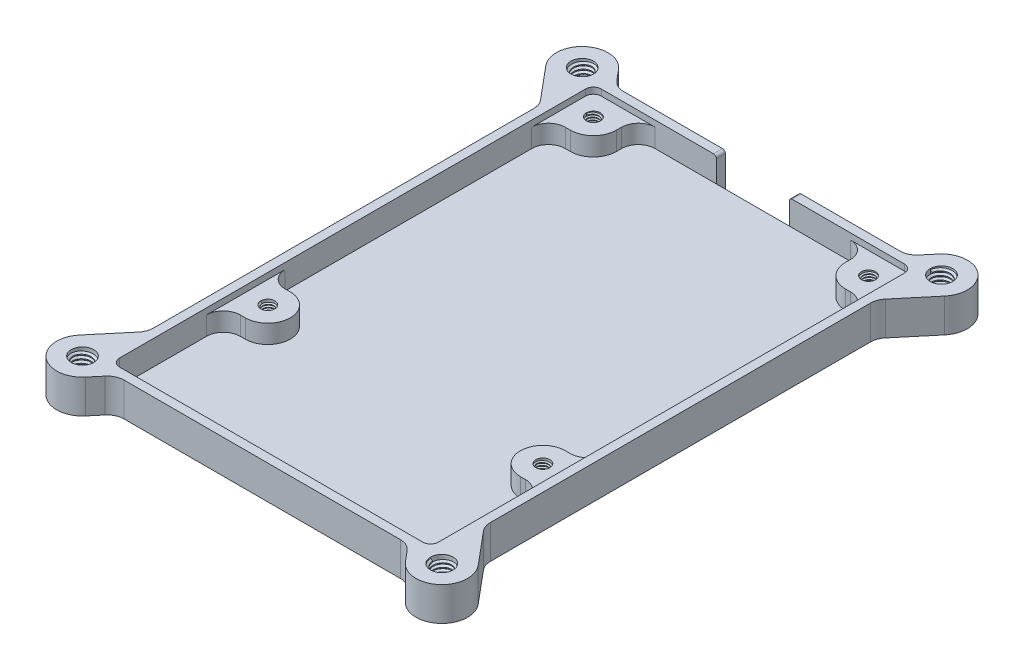
from build123d import *

# Parameters (mm, degrees)
SKETCH1_W                                 = 60
SKETCH1_H                                 = 89
BASE_DEPTH                                = 6
OUTSIDE_OF_BASE_R                         = 3
SHELL_T                                   = -1.6
SKETCH11_W                                = 13
SKETCH11_H                                = 6
SD_CARD_ACCESS_DEPTH                      = 1.6
TOP_START                                 = 6
TOP_COVER_FASTENING_BODY_DEPTH            = 6
M4X0_7_TAPPED_HOLE1_D                     = 4
THREAD1_PITCH                             = 0.7
TCFB_START                                = 6
TCFB_VM_COPY_1_DEPTH                      = 6
TCFB_VM_COPY_2_D                          = 4
TCFB_VM_COPY_3_PITCH                      = 0.7
FASTENER_START                            = 3.3
FASTENER_BOSSED_MOUNT_DEPTH               = 3.3
TAPPED_HOLE_D                             = 2.5
SKETCH_PATTERN_START                      = -1
SKETCH_PATTERN_M2_5_TAPPED_HOLE_OUTLINE_R = 1.25
SKETCH_PATTERN_M2_5_TAPPED_HOLE_DEPTH     = 5.9
M2_5_3D_PRINTED_THREAD_PITCH              = 0.45
TM_V_COPY_1_PITCH                         = 0.45
SDCA_F_R                                  = 0.5
FBM_F_R                                   = 3
TCFB_INNER_FILLET_R                       = 3
TCFB_OUTER_FILLET_R                       = 3


with BuildPart() as part:
    # Sketch1 → BASE (new body)
    with BuildSketch(Plane(origin=(0, 0, 0), x_dir=(1, 0, 0), z_dir=(0, 1, 0))):
        Rectangle(SKETCH1_W, SKETCH1_H)
    extrude(amount=BASE_DEPTH)

    # OUTSIDE OF BASE
    outside_of_base_edges = [part.edges().sort_by_distance(p)[0] for p in [
        (30, 3, 44.5),
        (-30, 3, 44.5),
        (-30, 3, -44.5),
        (30, 3, -44.5),
    ]]
    fillet(outside_of_base_edges, radius=OUTSIDE_OF_BASE_R)

    # SHELL
    shell_openings = [part.faces().sort_by_distance(p)[0] for p in [
        (0, 6, 0),
    ]]
    offset(amount=SHELL_T, openings=shell_openings, kind=Kind.INTERSECTION)

    # Sketch11 → SD CARD ACCESS (cut)
    with BuildSketch(Plane(origin=(0, 0, -44.5), x_dir=(-1, 0, 0), z_dir=(0, 0, -1))):
        with Locations((0, 3)):
            Rectangle(SKETCH11_W, SKETCH11_H)
    extrude(amount=-SD_CARD_ACCESS_DEPTH, mode=Mode.SUBTRACT)

    # Sketch21 → TOP COVER FASTENING BODY (add)
    with BuildSketch(Plane(origin=(0, 0, 0), x_dir=(1, 0, 0), z_dir=(0, 1, 0)).offset(TOP_START)):
        with BuildLine():
            Line((30, 41.5), (30, 34.947195978))
            Line((30, 34.947195978), (35.526666667, 41.546591423))
            ThreePointArc((35.526666667, 41.546591423), (34.953408577, 48.026666667), (28.473333333, 47.453408577))
            Line((28.473333333, 47.453408577), (26, 44.5))
            Line((26, 44.5), (27, 44.5))
            ThreePointArc((27, 44.5), (29.121320344, 43.621320344), (30, 41.5))
        make_face()
    top_cover_fastening_body = extrude(amount=-TOP_COVER_FASTENING_BODY_DEPTH)

    # M4x0.7 Tapped Hole1 (through all)
    with Locations(Plane(origin=(0, 6, 0), x_dir=(1, 0, 0), z_dir=(0, 1, 0))):
        with Locations((32, 44.5)):
            m4x0_7_tapped_hole1 = Hole(M4X0_7_TAPPED_HOLE1_D / 2)

    # Thread1: arcs per turn and ends read off the stored shape
    # Thread1: the profile of Thread Profile2 profile screwed along a right-hand helix through 7.428569 turns, 6 arcs to a turn; built about Z, then put on its axis
    thread1_z = Axis((0, 0, 0), (0, 0, 1))
    thread1_corners = [(2.0003, 0, -0.000173205), (2.0003, 0, 0.612673203), (1.621113888, 0, 0.393749999), (1.621113888, 0, 0.218749999)]
    with BuildLine(mode=Mode.PRIVATE) as thread1_profile:
        Line(thread1_corners[0], thread1_corners[1])
        Line(thread1_corners[1], thread1_corners[2])
        Line(thread1_corners[2], thread1_corners[3])
        Line(thread1_corners[3], thread1_corners[0])
    thread1_cap = Face(thread1_profile.wire())
    thread1_turn_angles = [0, 30, 60, 90, 120, 150, 180, 210, 240, 270, 300, 330, 360]
    thread1_turn_weights = [1, 0.8660254037844387, 1, 0.8660254037844387, 1, 0.8660254037844387, 1, 0.8660254037844387, 1, 0.8660254037844387, 1, 0.8660254037844387, 1]
    thread1_turn_rails = [Edge.make_bspline([Vector(p[0], p[1], 0).rotate(thread1_z, thread1_turn_angles[k]) / thread1_turn_weights[k] + Vector(0, 0, p[2] + THREAD1_PITCH * thread1_turn_angles[k] / 360) for k in range(13)], [0, 0, 0, 1, 1, 2, 2, 3, 3, 4, 4, 5, 5, 6, 6, 6], 2, thread1_turn_weights) for p in thread1_corners]
    thread1_turn_sides = [Face.make_surface_from_curves(thread1_turn_rails[p[0]], thread1_turn_rails[p[1]]) for p in [(0, 1), (1, 2), (2, 3), (3, 0)]]
    thread1_last_angles = [2520, 2550, 2580, 2610, 2640, 2657.1425, 2674.285]
    thread1_last_weights = [1, 0.8660254037844387, 1, 0.8660254037844387, 1, 0.9555746430705345, 1]
    thread1_last_rails = [Edge.make_bspline([Vector(p[0], p[1], 0).rotate(thread1_z, thread1_last_angles[k]) / thread1_last_weights[k] + Vector(0, 0, p[2] + THREAD1_PITCH * thread1_last_angles[k] / 360) for k in range(7)], [0, 0, 0, 1, 1, 2, 2, 3, 3, 3], 2, thread1_last_weights) for p in thread1_corners]
    thread1_last_sides = [Face.make_surface_from_curves(thread1_last_rails[p[0]], thread1_last_rails[p[1]]) for p in [(0, 1), (1, 2), (2, 3), (3, 0)]]
    thread1 = Plane(origin=(32, 5.8, -44.5), x_dir=(-1, 0, 0), z_dir=(0, -1, 0)) * Solid(Shell([*[p.moved(Location((0, 0, THREAD1_PITCH * i))) for i in range(7) for p in thread1_turn_sides], *thread1_last_sides, thread1_cap, thread1_cap.rotate(thread1_z, 2674.285).moved(Location((0, 0, THREAD1_PITCH * 2674.285 / 360)))]))
    add(thread1)

    # TCFB HM: TOP COVER FASTENING BODY, M4x0.7 Tapped Hole1, Thread1 across plane
    add(top_cover_fastening_body.mirror(Plane(origin=(0, 0, 0), x_dir=(0, 0, 1), z_dir=(1, 0, 0))))
    add(m4x0_7_tapped_hole1.mirror(Plane(origin=(0, 0, 0), x_dir=(0, 0, 1), z_dir=(1, 0, 0))), mode=Mode.SUBTRACT)
    add(thread1.mirror(Plane(origin=(0, 0, 0), x_dir=(0, 0, 1), z_dir=(1, 0, 0))))

    # TCFB VM: TOP COVER FASTENING BODY, M4x0.7 Tapped Hole1, Thread1 across plane
    add(top_cover_fastening_body.mirror(Plane.XY))
    add(m4x0_7_tapped_hole1.mirror(Plane.XY), mode=Mode.SUBTRACT)
    add(thread1.mirror(Plane.XY))

    # TCFB VM copy 1 sketch → TCFB VM copy 1 (add)
    with BuildSketch(Plane(origin=(0, 0, 0), x_dir=(-1, 0, 0), z_dir=(0, 1, 0)).offset(TCFB_START)):
        with BuildLine():
            Line((30, 41.5), (30, 34.947195978))
            Line((30, 34.947195978), (35.526666667, 41.546591423))
            ThreePointArc((35.526666667, 41.546591423), (34.953408577, 48.026666667), (28.473333333, 47.453408577))
            Line((28.473333333, 47.453408577), (26, 44.5))
            Line((26, 44.5), (27, 44.5))
            ThreePointArc((27, 44.5), (29.121320344, 43.621320344), (30, 41.5))
        make_face()
    extrude(amount=-TCFB_VM_COPY_1_DEPTH)

    # TCFB VM copy 2 (through all)
    with Locations(Plane(origin=(0, 6, 0), x_dir=(-1, 0, 0), z_dir=(0, 1, 0))):
        with Locations((32, 44.5)):
            Hole(TCFB_VM_COPY_2_D / 2)

    # TCFB VM copy 3: the profile of TCFB VM copy 3 sketch screwed along a right-hand helix through 7.428569 turns, 6 arcs to a turn; built about Z, then put on its axis
    tcfb_vm_copy_3_z = Axis((0, 0, 0), (0, 0, 1))
    tcfb_vm_copy_3_corners = [(2.0003, 0, -0.000173205), (2.0003, 0, 0.612673203), (1.621113888, 0, 0.393749999), (1.621113888, 0, 0.218749999)]
    with BuildLine(mode=Mode.PRIVATE) as tcfb_vm_copy_3_profile:
        Line(tcfb_vm_copy_3_corners[0], tcfb_vm_copy_3_corners[1])
        Line(tcfb_vm_copy_3_corners[1], tcfb_vm_copy_3_corners[2])
        Line(tcfb_vm_copy_3_corners[2], tcfb_vm_copy_3_corners[3])
        Line(tcfb_vm_copy_3_corners[3], tcfb_vm_copy_3_corners[0])
    tcfb_vm_copy_3_cap = Face(tcfb_vm_copy_3_profile.wire())
    tcfb_vm_copy_3_turn_angles = [0, 30, 60, 90, 120, 150, 180, 210, 240, 270, 300, 330, 360]
    tcfb_vm_copy_3_turn_weights = [1, 0.8660254037844387, 1, 0.8660254037844387, 1, 0.8660254037844387, 1, 0.8660254037844387, 1, 0.8660254037844387, 1, 0.8660254037844387, 1]
    tcfb_vm_copy_3_turn_rails = [Edge.make_bspline([Vector(p[0], p[1], 0).rotate(tcfb_vm_copy_3_z, tcfb_vm_copy_3_turn_angles[k]) / tcfb_vm_copy_3_turn_weights[k] + Vector(0, 0, p[2] + TCFB_VM_COPY_3_PITCH * tcfb_vm_copy_3_turn_angles[k] / 360) for k in range(13)], [0, 0, 0, 1, 1, 2, 2, 3, 3, 4, 4, 5, 5, 6, 6, 6], 2, tcfb_vm_copy_3_turn_weights) for p in tcfb_vm_copy_3_corners]
    tcfb_vm_copy_3_turn_sides = [Face.make_surface_from_curves(tcfb_vm_copy_3_turn_rails[p[0]], tcfb_vm_copy_3_turn_rails[p[1]]) for p in [(0, 1), (1, 2), (2, 3), (3, 0)]]
    tcfb_vm_copy_3_last_angles = [2520, 2550, 2580, 2610, 2640, 2657.1425, 2674.285]
    tcfb_vm_copy_3_last_weights = [1, 0.8660254037844387, 1, 0.8660254037844387, 1, 0.9555746430705345, 1]
    tcfb_vm_copy_3_last_rails = [Edge.make_bspline([Vector(p[0], p[1], 0).rotate(tcfb_vm_copy_3_z, tcfb_vm_copy_3_last_angles[k]) / tcfb_vm_copy_3_last_weights[k] + Vector(0, 0, p[2] + TCFB_VM_COPY_3_PITCH * tcfb_vm_copy_3_last_angles[k] / 360) for k in range(7)], [0, 0, 0, 1, 1, 2, 2, 3, 3, 3], 2, tcfb_vm_copy_3_last_weights) for p in tcfb_vm_copy_3_corners]
    tcfb_vm_copy_3_last_sides = [Face.make_surface_from_curves(tcfb_vm_copy_3_last_rails[p[0]], tcfb_vm_copy_3_last_rails[p[1]]) for p in [(0, 1), (1, 2), (2, 3), (3, 0)]]
    tcfb_vm_copy_3 = Plane(origin=(-32, 5.8, 44.5), x_dir=(1, 0, 0), z_dir=(0, -1, 0)) * Solid(Shell([*[p.moved(Location((0, 0, TCFB_VM_COPY_3_PITCH * i))) for i in range(7) for p in tcfb_vm_copy_3_turn_sides], *tcfb_vm_copy_3_last_sides, tcfb_vm_copy_3_cap, tcfb_vm_copy_3_cap.rotate(tcfb_vm_copy_3_z, 2674.285).moved(Location((0, 0, TCFB_VM_COPY_3_PITCH * 2674.285 / 360)))]))
    add(tcfb_vm_copy_3)

    # Sketch3 → FASTENER BOSSED MOUNT (add)
    with BuildSketch(Plane(origin=(0, 1.6, 0), x_dir=(1, 0, 0), z_dir=(0, 1, 0)).offset(FASTENER_START)):
        with BuildLine():
            Line((-28.4, 41.5), (-28.4, 34.9))
            Line((-28.4, 34.9), (-24.5, 34.9))
            ThreePointArc((-24.5, 34.9), (-21.600862197, 36.100862197), (-20.4, 39))
            Line((-20.4, 39), (-20.4, 42.9))
            Line((-20.4, 42.9), (-27, 42.9))
            ThreePointArc((-27, 42.9), (-27.989949494, 42.489949494), (-28.4, 41.5))
        make_face()
        with BuildLine():
            Line((-28.4, -23), (-24.5, -23))
            ThreePointArc((-24.5, -23), (-20.5, -19), (-24.5, -15))
            Line((-24.5, -15), (-28.4, -15))
            Line((-28.4, -15), (-28.4, -23))
        make_face()
    fastener_bossed_mount = extrude(amount=-FASTENER_BOSSED_MOUNT_DEPTH)

    # FBM M: FASTENER BOSSED MOUNT across plane
    add(fastener_bossed_mount.mirror(Plane(origin=(0, 0, 0), x_dir=(0, 0, 1), z_dir=(1, 0, 0))))

    # Tapped Hole (through all)
    with Locations(Plane(origin=(0, 4.9, 0), x_dir=(1, 0, 0), z_dir=(0, 1, 0))):
        with Locations((-24.5, 39)):
            Hole(TAPPED_HOLE_D / 2)

    # Sketch-Pattern M2.5 TAPPED HOLE: read off the stored shape, not the designer's step
    # Sketch-Pattern M2.5 TAPPED HOLE outline → Sketch-Pattern M2.5 TAPPED HOLE (cut)
    with BuildSketch(Plane(origin=(0, 0, 0), x_dir=(1, 0, 0), z_dir=(0, 1, 0)).offset(SKETCH_PATTERN_START)):
        with Locations((-24.5, -19)):
            Circle(SKETCH_PATTERN_M2_5_TAPPED_HOLE_OUTLINE_R)
        with Locations((24.5, -19)):
            Circle(SKETCH_PATTERN_M2_5_TAPPED_HOLE_OUTLINE_R)
        with Locations((24.5, 39)):
            Circle(SKETCH_PATTERN_M2_5_TAPPED_HOLE_OUTLINE_R)
    extrude(amount=SKETCH_PATTERN_M2_5_TAPPED_HOLE_DEPTH, mode=Mode.SUBTRACT)

    # M2.5 3D PRINTED THREAD: arcs per turn and ends read off the stored shape
    # M2.5 3D PRINTED THREAD: the profile of Thread Profile1 profile screwed along a right-hand helix through 9.333333 turns, 6 arcs to a turn; built about Z, then put on its axis
    m2_5_3d_printed_thread_z = Axis((0, 0, 0), (0, 0, 1))
    m2_5_3d_printed_thread_corners = [(1.2503, 0, -0.000173205), (1.2503, 0, 0.393923204), (1.006430356, 0, 0.253124999), (1.006430356, 0, 0.140624999)]
    with BuildLine(mode=Mode.PRIVATE) as m2_5_3d_printed_thread_profile:
        Line(m2_5_3d_printed_thread_corners[0], m2_5_3d_printed_thread_corners[1])
        Line(m2_5_3d_printed_thread_corners[1], m2_5_3d_printed_thread_corners[2])
        Line(m2_5_3d_printed_thread_corners[2], m2_5_3d_printed_thread_corners[3])
        Line(m2_5_3d_printed_thread_corners[3], m2_5_3d_printed_thread_corners[0])
    m2_5_3d_printed_thread_cap = Face(m2_5_3d_printed_thread_profile.wire())
    m2_5_3d_printed_thread_turn_angles = [0, 30, 60, 90, 120, 150, 180, 210, 240, 270, 300, 330, 360]
    m2_5_3d_printed_thread_turn_weights = [1, 0.8660254037844387, 1, 0.8660254037844387, 1, 0.8660254037844387, 1, 0.8660254037844387, 1, 0.8660254037844387, 1, 0.8660254037844387, 1]
    m2_5_3d_printed_thread_turn_rails = [Edge.make_bspline([Vector(p[0], p[1], 0).rotate(m2_5_3d_printed_thread_z, m2_5_3d_printed_thread_turn_angles[k]) / m2_5_3d_printed_thread_turn_weights[k] + Vector(0, 0, p[2] + M2_5_3D_PRINTED_THREAD_PITCH * m2_5_3d_printed_thread_turn_angles[k] / 360) for k in range(13)], [0, 0, 0, 1, 1, 2, 2, 3, 3, 4, 4, 5, 5, 6, 6, 6], 2, m2_5_3d_printed_thread_turn_weights) for p in m2_5_3d_printed_thread_corners]
    m2_5_3d_printed_thread_turn_sides = [Face.make_surface_from_curves(m2_5_3d_printed_thread_turn_rails[p[0]], m2_5_3d_printed_thread_turn_rails[p[1]]) for p in [(0, 1), (1, 2), (2, 3), (3, 0)]]
    m2_5_3d_printed_thread_last_angles = [3240, 3270, 3300, 3330, 3360]
    m2_5_3d_printed_thread_last_weights = [1, 0.8660254037844387, 1, 0.8660254037844387, 1]
    m2_5_3d_printed_thread_last_rails = [Edge.make_bspline([Vector(p[0], p[1], 0).rotate(m2_5_3d_printed_thread_z, m2_5_3d_printed_thread_last_angles[k]) / m2_5_3d_printed_thread_last_weights[k] + Vector(0, 0, p[2] + M2_5_3D_PRINTED_THREAD_PITCH * m2_5_3d_printed_thread_last_angles[k] / 360) for k in range(5)], [0, 0, 0, 1, 1, 2, 2, 2], 2, m2_5_3d_printed_thread_last_weights) for p in m2_5_3d_printed_thread_corners]
    m2_5_3d_printed_thread_last_sides = [Face.make_surface_from_curves(m2_5_3d_printed_thread_last_rails[p[0]], m2_5_3d_printed_thread_last_rails[p[1]]) for p in [(0, 1), (1, 2), (2, 3), (3, 0)]]
    m2_5_3d_printed_thread = Plane(origin=(-24.5, 4.8, -39), x_dir=(-1, 0, 0), z_dir=(0, -1, 0)) * Solid(Shell([*[p.moved(Location((0, 0, M2_5_3D_PRINTED_THREAD_PITCH * i))) for i in range(9) for p in m2_5_3d_printed_thread_turn_sides], *m2_5_3d_printed_thread_last_sides, m2_5_3d_printed_thread_cap, m2_5_3d_printed_thread_cap.rotate(m2_5_3d_printed_thread_z, 3360).moved(Location((0, 0, M2_5_3D_PRINTED_THREAD_PITCH * 3360 / 360)))]))
    add(m2_5_3d_printed_thread)

    # TM H: M2.5 3D PRINTED THREAD across plane
    add(m2_5_3d_printed_thread.mirror(Plane(origin=(0, 0, 0), x_dir=(0, 0, 1), z_dir=(1, 0, 0))))

    # TM V: M2.5 3D PRINTED THREAD across plane
    add(m2_5_3d_printed_thread.mirror(Plane.XY.offset(-10)))

    # TM V copy 1: the profile of TM V copy 1 sketch screwed along a right-hand helix through 9.333333 turns, 6 arcs to a turn; built about Z, then put on its axis
    tm_v_copy_1_z = Axis((0, 0, 0), (0, 0, 1))
    tm_v_copy_1_corners = [(1.2503, 0, -0.000173205), (1.2503, 0, 0.393923204), (1.006430356, 0, 0.253124999), (1.006430356, 0, 0.140624999)]
    with BuildLine(mode=Mode.PRIVATE) as tm_v_copy_1_profile:
        Line(tm_v_copy_1_corners[0], tm_v_copy_1_corners[1])
        Line(tm_v_copy_1_corners[1], tm_v_copy_1_corners[2])
        Line(tm_v_copy_1_corners[2], tm_v_copy_1_corners[3])
        Line(tm_v_copy_1_corners[3], tm_v_copy_1_corners[0])
    tm_v_copy_1_cap = Face(tm_v_copy_1_profile.wire())
    tm_v_copy_1_turn_angles = [0, 30, 60, 90, 120, 150, 180, 210, 240, 270, 300, 330, 360]
    tm_v_copy_1_turn_weights = [1, 0.8660254037844387, 1, 0.8660254037844387, 1, 0.8660254037844387, 1, 0.8660254037844387, 1, 0.8660254037844387, 1, 0.8660254037844387, 1]
    tm_v_copy_1_turn_rails = [Edge.make_bspline([Vector(p[0], p[1], 0).rotate(tm_v_copy_1_z, tm_v_copy_1_turn_angles[k]) / tm_v_copy_1_turn_weights[k] + Vector(0, 0, p[2] + TM_V_COPY_1_PITCH * tm_v_copy_1_turn_angles[k] / 360) for k in range(13)], [0, 0, 0, 1, 1, 2, 2, 3, 3, 4, 4, 5, 5, 6, 6, 6], 2, tm_v_copy_1_turn_weights) for p in tm_v_copy_1_corners]
    tm_v_copy_1_turn_sides = [Face.make_surface_from_curves(tm_v_copy_1_turn_rails[p[0]], tm_v_copy_1_turn_rails[p[1]]) for p in [(0, 1), (1, 2), (2, 3), (3, 0)]]
    tm_v_copy_1_last_angles = [3240, 3270, 3300, 3330, 3360]
    tm_v_copy_1_last_weights = [1, 0.8660254037844387, 1, 0.8660254037844387, 1]
    tm_v_copy_1_last_rails = [Edge.make_bspline([Vector(p[0], p[1], 0).rotate(tm_v_copy_1_z, tm_v_copy_1_last_angles[k]) / tm_v_copy_1_last_weights[k] + Vector(0, 0, p[2] + TM_V_COPY_1_PITCH * tm_v_copy_1_last_angles[k] / 360) for k in range(5)], [0, 0, 0, 1, 1, 2, 2, 2], 2, tm_v_copy_1_last_weights) for p in tm_v_copy_1_corners]
    tm_v_copy_1_last_sides = [Face.make_surface_from_curves(tm_v_copy_1_last_rails[p[0]], tm_v_copy_1_last_rails[p[1]]) for p in [(0, 1), (1, 2), (2, 3), (3, 0)]]
    tm_v_copy_1 = Plane(origin=(24.5, 4.8, 19), x_dir=(1, 0, 0), z_dir=(0, -1, 0)) * Solid(Shell([*[p.moved(Location((0, 0, TM_V_COPY_1_PITCH * i))) for i in range(9) for p in tm_v_copy_1_turn_sides], *tm_v_copy_1_last_sides, tm_v_copy_1_cap, tm_v_copy_1_cap.rotate(tm_v_copy_1_z, 3360).moved(Location((0, 0, TM_V_COPY_1_PITCH * 3360 / 360)))]))
    add(tm_v_copy_1)

    # SDCA F
    sdca_f_edges = [part.edges().sort_by_distance(p)[0] for p in [
        (6.5, 6, -43.7),
        (-6.5, 6, -43.7),
    ]]
    fillet(sdca_f_edges, radius=SDCA_F_R)

    # FBM F
    fbm_f_edges = [part.edges().sort_by_distance(p)[0] for p in [
        (-28.4, 3.25, 15),
        (-28.4, 3.25, 23),
        (-28.4, 3.25, -34.9),
        (-20.4, 3.25, -42.9),
        (28.4, 3.25, 23),
        (28.4, 3.25, 15),
        (20.4, 3.25, -42.9),
        (28.4, 3.25, -34.9),
    ]]
    fillet(fbm_f_edges, radius=FBM_F_R)

    # TCFB INNER FILLET
    tcfb_inner_fillet_edges = [part.edges().sort_by_distance(p)[0] for p in [
        (-30, 3, -34.947195978),
        (30, 3, 34.947195978),
        (-30, 3, 34.947195978),
        (30, 3, -34.947195978),
    ]]
    fillet(tcfb_inner_fillet_edges, radius=TCFB_INNER_FILLET_R)

    # TCFB OUTER FILLET
    tcfb_outer_fillet_edges = [part.edges().sort_by_distance(p)[0] for p in [
        (-26, 3, -44.5),
        (26, 3, 44.5),
        (-26, 3, 44.5),
        (26, 3, -44.5),
    ]]
    fillet(tcfb_outer_fillet_edges, radius=TCFB_OUTER_FILLET_R)


solid = part.part
